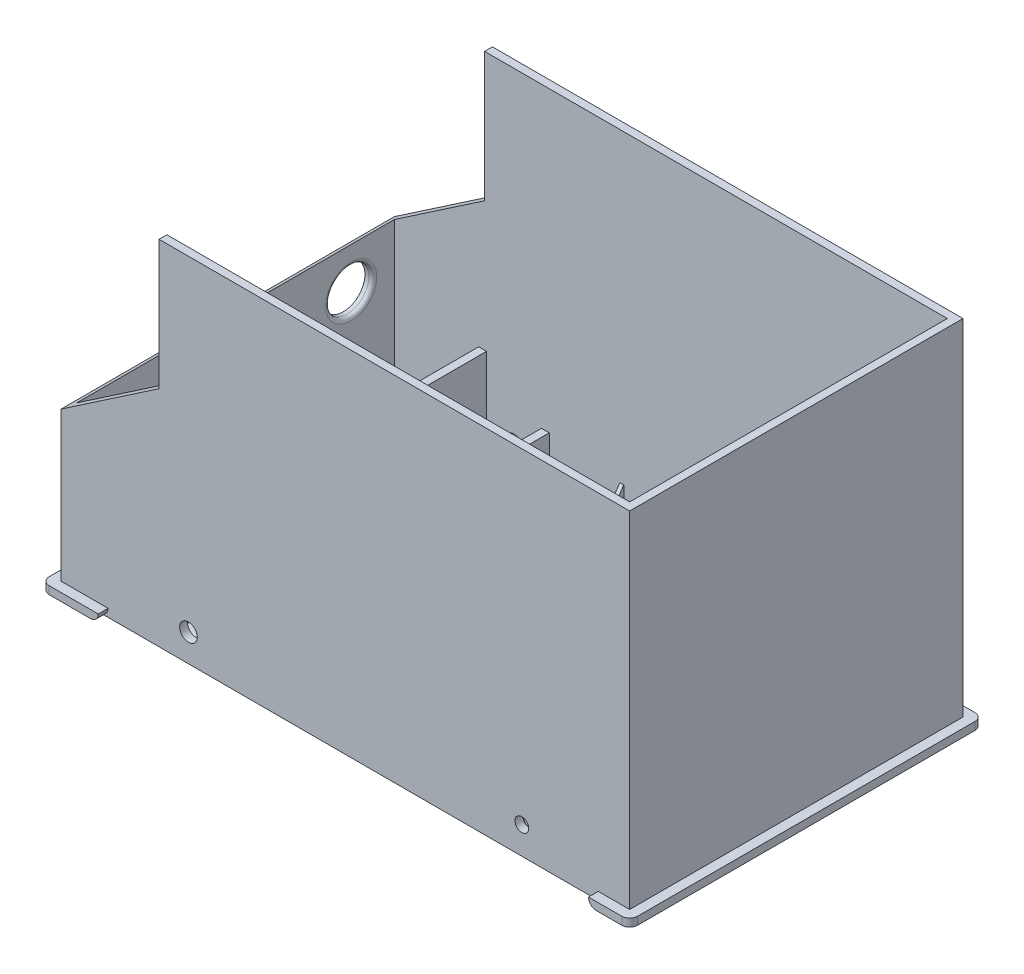
from build123d import *

# Parameters (mm, degrees)
ESQUISSE1_W              = 150
ESQUISSE1_H              = 90
BOSS_EXTRU_1_DEPTH       = 2
ESQUISSE2_W              = 145
ESQUISSE2_H              = 85
ESQUISSE2_W_2            = 141
ESQUISSE2_H_2            = 81
BOSS_EXTRU_2_DEPTH       = 88
ESQUISSE3_R              = 15
ENL_V_MAT_EXTRU_1_DEPTH  = 2
ENL_V_MAT_EXTRU_2_DEPTH  = 90
ESQUISSE6_R              = 2.25
ENL_V_MAT_EXTRU_4_DEPTH  = 90
CONG_1_R                 = 2
ESQUISSE9_W              = 2
ESQUISSE9_H              = 22
BOSS_EXTRU_5_DEPTH       = 81
ESQUISSE11_W             = 3.5
ESQUISSE11_H             = 2
BOSS_EXTRU_6_DEPTH       = 12
ESQUISSE13_R             = 5.5
ENL_V_MAT_EXTRU_5_DEPTH  = 2
CONG_2_R                 = 1
ESQUISSE14_W             = 22
ESQUISSE14_H             = 2
BOSS_EXTRU_7_DEPTH       = 65
ESQUISSE16_W             = 125
ESQUISSE16_H             = 2
ENL_V_MAT_EXTRU_6_DEPTH  = 2.5
ESQUISSE18_W             = 125.5
ESQUISSE18_H             = 2
ENL_V_MAT_EXTRU_7_DEPTH  = 2.5
CONG_3_R                 = 2
ESQUISSE26_R             = 1.75
ENL_V_MAT_EXTRU_12_DEPTH = 85
ESQUISSE19_W             = 14
ESQUISSE19_H             = 10
ENL_V_MAT_EXTRU_8_DEPTH  = 2
ESQUISSE20_W             = 15.6
ESQUISSE20_H             = 14
BOSS_EXTRU_8_DEPTH       = 15
ESQUISSE23_W             = 22
ESQUISSE23_H             = 30
ENL_V_MAT_EXTRU_10_DEPTH = 44.5
ESQUISSE21_W             = 12.6
ESQUISSE21_H             = 10.4
ENL_V_MAT_EXTRU_9_DEPTH  = 15
ESQUISSE27_R             = 3.75
BOSS_EXTRU_9_DEPTH       = 4
ESQUISSE29_R             = 1.65
ENL_V_MAT_EXTRU_13_DEPTH = 4
BOSS_EXTRU_10_START      = 4
ESQUISSE30_R             = 3.75
BOSS_EXTRU_10_DEPTH      = 4
ESQUISSE31_R             = 1.65
ENL_V_MAT_EXTRU_14_DEPTH = 4
CONG_4_R                 = 2
CONG_5_R                 = 2
ESQUISSE38_W             = 13
ESQUISSE38_H             = 34
BOSS_EXTRU_13_DEPTH      = 12
ESQUISSE40_W             = 11
ESQUISSE40_H             = 32
ENL_V_MAT_EXTRU_18_DEPTH = 11.99
ESQUISSE41_W             = 9
ESQUISSE41_H             = 11.99
ENL_V_MAT_EXTRU_19_DEPTH = 1
ESQUISSE33_W             = 1
ESQUISSE33_H             = 7
ESQUISSE33_W_2           = 3
ESQUISSE33_H_2           = 1.5
BOSS_EXTRU_11_DEPTH      = 10
ENL_V_MAT_EXTRU_15_DEPTH = 1
ENL_V_MAT_EXTRU_16_DEPTH = 1
ESQUISSE36_W             = 5
ESQUISSE36_H             = 1
BOSS_EXTRU_12_DEPTH      = 10
ENL_V_MAT_EXTRU_17_DEPTH = 1


# Some blends are built 0.0001 mm under size
with BuildPart() as part:
    # Esquisse1 → Boss.-Extru.1 (new body)
    with BuildSketch(Plane.XZ):
        with Locations((75, 45)):
            Rectangle(ESQUISSE1_W, ESQUISSE1_H)
    extrude(amount=BOSS_EXTRU_1_DEPTH)

    # Esquisse2 → Boss.-Extru.2 (add)
    with BuildSketch(Plane(origin=(0, 0, 0), x_dir=(1, 0, 0), z_dir=(0, 1, 0))):
        with Locations((75, -45)):
            Rectangle(ESQUISSE2_W, ESQUISSE2_H)
        with Locations((75, -45)):
            Rectangle(ESQUISSE2_W_2, ESQUISSE2_H_2, mode=Mode.SUBTRACT)
    extrude(amount=BOSS_EXTRU_2_DEPTH)

    # Esquisse3 → Enlèv. mat.-Extru.1 (cut)
    with BuildSketch(Plane(origin=(0, 0, 0), x_dir=(1, 0, 0), z_dir=(0, 1, 0))):
        with Locations(Location((77.5, -45, 0), (0, 0, 270))):
            Circle(ESQUISSE3_R)
    extrude(amount=-ENL_V_MAT_EXTRU_1_DEPTH, mode=Mode.SUBTRACT)

    # Esquisse4 → Enlèv. mat.-Extru.2 (cut)
    with BuildSketch(Plane.XY.offset(87.5)):
        Polygon((2.5, 38), (27.5, 55), (27.5, 88), (2.5, 88), align=None)
    extrude(amount=-ENL_V_MAT_EXTRU_2_DEPTH, mode=Mode.SUBTRACT)

    # Esquisse6 → Enlèv. mat.-Extru.4 (cut)
    with BuildSketch(Plane(origin=(0, 0, 2.5), x_dir=(-1, 0, 0), z_dir=(0, 0, -1))):
        with Locations((-35, 5)):
            Circle(ESQUISSE6_R)
    extrude(amount=-ENL_V_MAT_EXTRU_4_DEPTH, mode=Mode.SUBTRACT)

    # Congé1
    cong_1_edges = [part.edges().sort_by_distance(p)[0] for p in [
        (150, -1, 0),
        (0, -1, 0),
        (0, -1, 90),
        (150, -1, 90),
    ]]
    fillet(cong_1_edges, radius=CONG_1_R)

    # Esquisse9 → Boss.-Extru.5 (add)
    with BuildSketch(Plane(origin=(0, 0, 85.5), x_dir=(-1, 0, 0), z_dir=(0, 0, -1))):
        with Locations((-27, 11)):
            Rectangle(ESQUISSE9_W, ESQUISSE9_H)
    extrude(amount=BOSS_EXTRU_5_DEPTH)

    # Esquisse11 → Boss.-Extru.6 (add)
    with BuildSketch(Plane(origin=(0, 0, 0), x_dir=(1, 0, 0), z_dir=(0, 1, 0))):
        with Locations((29.75, -57)):
            Rectangle(ESQUISSE11_W, ESQUISSE11_H)
        with Locations((29.75, -33)):
            Rectangle(ESQUISSE11_W, ESQUISSE11_H)
        Polygon((37, -32), (37, -34), (44, -34), (44, -4.5), (42, -4.5), (42, -32), align=None)
        Polygon((37, -56), (44, -56), (44, -85.5), (42, -85.5), (42, -58), (37, -58), align=None)
    extrude(amount=BOSS_EXTRU_6_DEPTH)

    # Esquisse13 → Enlèv. mat.-Extru.5 (cut)
    with BuildSketch(Plane.ZY.offset(-2.5)):
        with Locations((15.5, 29)):
            Circle(ESQUISSE13_R)
        with Locations((74.5, 29)):
            Circle(ESQUISSE13_R)
    extrude(amount=-ENL_V_MAT_EXTRU_5_DEPTH, mode=Mode.SUBTRACT)

    # Congé2
    cong_2_edges = [part.edges().sort_by_distance(p)[0] for p in [
        (4.5, 29, 10),
        (4.5, 29, 69),
    ]]
    fillet(cong_2_edges, radius=CONG_2_R)

    # Esquisse14 → Boss.-Extru.7 (add)
    with BuildSketch(Plane(origin=(0, 0, 0), x_dir=(1, 0, 0), z_dir=(0, 1, 0))):
        with Locations((134.5, -25.7)):
            Rectangle(ESQUISSE14_W, ESQUISSE14_H)
        with Locations((134.5, -68.2)):
            Rectangle(ESQUISSE14_W, ESQUISSE14_H)
    extrude(amount=BOSS_EXTRU_7_DEPTH)

    # Esquisse16 → Enlèv. mat.-Extru.6 (cut)
    with BuildSketch(Plane.XY.offset(90)):
        with Locations((77, -1)):
            Rectangle(ESQUISSE16_W, ESQUISSE16_H)
    extrude(amount=-ENL_V_MAT_EXTRU_6_DEPTH, mode=Mode.SUBTRACT)

    # Esquisse18 → Enlèv. mat.-Extru.7 (cut)
    with BuildSketch(Plane(origin=(0, 0, 0), x_dir=(-1, 0, 0), z_dir=(0, 0, -1))):
        with Locations((-77.25, -1)):
            Rectangle(ESQUISSE18_W, ESQUISSE18_H)
    extrude(amount=-ENL_V_MAT_EXTRU_7_DEPTH, mode=Mode.SUBTRACT)

    # Congé3
    cong_3_edges = [part.edges().sort_by_distance(p)[0] for p in [
        (140, -2, 1.25),
        (14.5, -2, 1.25),
        (14.5, -2, 88.75),
        (139.5, -2, 88.75),
    ]]
    fillet(cong_3_edges, radius=CONG_3_R - 0.0001)  # a hair under: the kernel refuses the full size

    # Esquisse26 → Enlèv. mat.-Extru.12 (cut)
    with BuildSketch(Plane(origin=(0, 0, 2.5), x_dir=(-1, 0, 0), z_dir=(0, 0, -1))):
        with Locations((-120, 5)):
            Circle(ESQUISSE26_R)
    extrude(amount=-ENL_V_MAT_EXTRU_12_DEPTH, mode=Mode.SUBTRACT)

    # Esquisse19 → Enlèv. mat.-Extru.8 (cut)
    with BuildSketch(Plane(origin=(28, 0, 0), x_dir=(0, 0, -1), z_dir=(1, 0, 0))):
        with Locations((-45, 5)):
            Rectangle(ESQUISSE19_W, ESQUISSE19_H)
    extrude(amount=-ENL_V_MAT_EXTRU_8_DEPTH, mode=Mode.SUBTRACT)

    # Esquisse20 → Boss.-Extru.8 (add)
    with BuildSketch(Plane(origin=(0, 0, 0), x_dir=(1, 0, 0), z_dir=(0, 1, 0))):
        with Locations((115.3, -24.4)):
            Rectangle(ESQUISSE20_W, ESQUISSE20_H)
        with Locations((115.3, -52.37)):
            Rectangle(ESQUISSE20_W, ESQUISSE20_H)
    extrude(amount=BOSS_EXTRU_8_DEPTH)

    # Esquisse23 → Enlèv. mat.-Extru.10 (cut)
    with BuildSketch(Plane(origin=(0, 0, 24.7), x_dir=(-1, 0, 0), z_dir=(0, 0, -1))):
        with Locations((-134.5, 35)):
            Rectangle(ESQUISSE23_W, ESQUISSE23_H)
    extrude(amount=-ENL_V_MAT_EXTRU_10_DEPTH, mode=Mode.SUBTRACT)

    # Esquisse21 → Enlèv. mat.-Extru.9 (cut)
    with BuildSketch(Plane(origin=(0, 15, 0), x_dir=(1, 0, 0), z_dir=(0, 1, 0))):
        with Locations((115.8, -24.4)):
            Rectangle(ESQUISSE21_W, ESQUISSE21_H)
        with Locations((115.8, -52.37)):
            Rectangle(ESQUISSE21_W, ESQUISSE21_H)
    extrude(amount=-ENL_V_MAT_EXTRU_9_DEPTH, mode=Mode.SUBTRACT)

    # Esquisse27 → Boss.-Extru.9 (add)
    with BuildSketch(Plane.XY.offset(4.5)):
        with Locations((120, 5)):
            Circle(ESQUISSE27_R)
    extrude(amount=BOSS_EXTRU_9_DEPTH)

    # Esquisse29 → Enlèv. mat.-Extru.13 (cut)
    with BuildSketch(Plane.XY.offset(8.5)):
        with Locations((120, 5)):
            Circle(ESQUISSE29_R)
    extrude(amount=-ENL_V_MAT_EXTRU_13_DEPTH, mode=Mode.SUBTRACT)

    # Esquisse30 → Boss.-Extru.10 (add)
    with BuildSketch(Plane(origin=(0, 0, 85.5), x_dir=(-1, 0, 0), z_dir=(0, 0, -1)).offset(BOSS_EXTRU_10_START)):
        with Locations(Location((-120, 5, 0), (0, 0, 180))):
            Circle(ESQUISSE30_R)
    extrude(amount=-BOSS_EXTRU_10_DEPTH)

    # Esquisse31 → Enlèv. mat.-Extru.14 (cut)
    with BuildSketch(Plane.XY.offset(85.5)):
        with Locations((120, 5)):
            Circle(ESQUISSE31_R)
    extrude(amount=-ENL_V_MAT_EXTRU_14_DEPTH, mode=Mode.SUBTRACT)

    # Congé4
    # the kernel refuses this fillet: 2 mm, written as the material it adds along each edge
    with BuildSketch(Plane(origin=(120, 5, 85.5), x_dir=(1, 0, 0), z_dir=(0, 1, 0))) as cong_4_piece_1:
        with BuildLine():
            CenterArc((3.75 + CONG_4_R, CONG_4_R), CONG_4_R, 180, 90)
            Line((3.75, CONG_4_R), (3.75, 0))
            Line((3.75, 0), (3.75 + CONG_4_R, 0))
        make_face()
    revolve(axis=Axis((120, 5, 85.5), (0, 0, -1)))

    # Congé5
    # the kernel refuses this fillet: 2 mm, written as the material it adds along each edge
    with BuildSketch(Plane(origin=(120, 5, 4.5), x_dir=(1, 0, 0), z_dir=(0, -1, 0))) as cong_5_piece_1:
        with BuildLine():
            CenterArc((3.75 + CONG_5_R, CONG_5_R), CONG_5_R, 180, 90)
            Line((3.75, CONG_5_R), (3.75, 0))
            Line((3.75, 0), (3.75 + CONG_5_R, 0))
        make_face()
    revolve(axis=Axis((120, 5, 4.5), (0, 0, 1)))

    # Esquisse38 → Boss.-Extru.13 (add)
    with BuildSketch(Plane(origin=(0, 0, 0), x_dir=(1, 0, 0), z_dir=(0, 1, 0))):
        with Locations((98, -41.5)):
            Rectangle(ESQUISSE38_W, ESQUISSE38_H)
    extrude(amount=BOSS_EXTRU_13_DEPTH)

    # Esquisse40 → Enlèv. mat.-Extru.18 (cut)
    with BuildSketch(Plane(origin=(0, 12, 0), x_dir=(1, 0, 0), z_dir=(0, 1, 0))):
        with Locations((98, -41.5)):
            Rectangle(ESQUISSE40_W, ESQUISSE40_H)
    extrude(amount=-ENL_V_MAT_EXTRU_18_DEPTH, mode=Mode.SUBTRACT)

    # Esquisse41 → Enlèv. mat.-Extru.19 (cut)
    with BuildSketch(Plane.XY.offset(25.5)):
        with Locations((98, 6.005)):
            Rectangle(ESQUISSE41_W, ESQUISSE41_H)
    extrude(amount=-ENL_V_MAT_EXTRU_19_DEPTH, mode=Mode.SUBTRACT)

    # Esquisse33 → Boss.-Extru.11 (add)
    with BuildSketch(Plane(origin=(0, 0, 0), x_dir=(1, 0, 0), z_dir=(0, 1, 0))):
        with Locations((62.5, -8)):
            Rectangle(ESQUISSE33_W, ESQUISSE33_H)
        with Locations((136, -8)):
            Rectangle(ESQUISSE33_W, ESQUISSE33_H)
        with Locations((136, -21.2)):
            Rectangle(ESQUISSE33_W, ESQUISSE33_H)
        with Locations((136, -72.7)):
            Rectangle(ESQUISSE33_W, ESQUISSE33_H)
        with Locations((136, -82)):
            Rectangle(ESQUISSE33_W, ESQUISSE33_H)
        with Locations((62.5, -82)):
            Rectangle(ESQUISSE33_W, ESQUISSE33_H)
        with Locations((106, -53.62)):
            Rectangle(ESQUISSE33_W_2, ESQUISSE33_H_2)
        with Locations((106, -29.15)):
            Rectangle(ESQUISSE33_W_2, ESQUISSE33_H_2)
    extrude(amount=BOSS_EXTRU_11_DEPTH)

    # Esquisse34 → Enlèv. mat.-Extru.15 (cut)
    with BuildSketch(Plane.ZY.offset(-62)):
        Polygon((4.5, 10), (11.5, 0), (11.5, 10), align=None)
        Polygon((85.5, 10), (78.5, 0), (78.5, 10), align=None)
    extrude(amount=-ENL_V_MAT_EXTRU_15_DEPTH, mode=Mode.SUBTRACT)

    # Esquisse35 → Enlèv. mat.-Extru.16 (cut)
    with BuildSketch(Plane.ZY.offset(-135.5)):
        Polygon((4.5, 10), (11.5, 0), (11.5, 10), align=None)
        Polygon((24.7, 10), (17.7, 0), (17.7, 10), align=None)
        Polygon((69.2, 10), (76.2, 0), (76.2, 10), align=None)
        Polygon((85.5, 10), (78.5, 0), (78.5, 10), align=None)
    extrude(amount=-ENL_V_MAT_EXTRU_16_DEPTH, mode=Mode.SUBTRACT)

    # Esquisse36 → Boss.-Extru.12 (add)
    with BuildSketch(Plane.ZY.offset(-145.5)):
        with Locations((22.2, 57)):
            Rectangle(ESQUISSE36_W, ESQUISSE36_H)
        with Locations((71.7, 57)):
            Rectangle(ESQUISSE36_W, ESQUISSE36_H)
    extrude(amount=BOSS_EXTRU_12_DEPTH)

    # Esquisse37 → Enlèv. mat.-Extru.17 (cut)
    with BuildSketch(Plane(origin=(0, 57.5, 0), x_dir=(1, 0, 0), z_dir=(0, 1, 0))):
        Polygon((145.5, -19.7), (135.5, -24.7), (135.5, -19.7), align=None)
        Polygon((145.5, -74.2), (135.5, -69.2), (135.5, -74.2), align=None)
    extrude(amount=-ENL_V_MAT_EXTRU_17_DEPTH, mode=Mode.SUBTRACT)


solid = part.part
